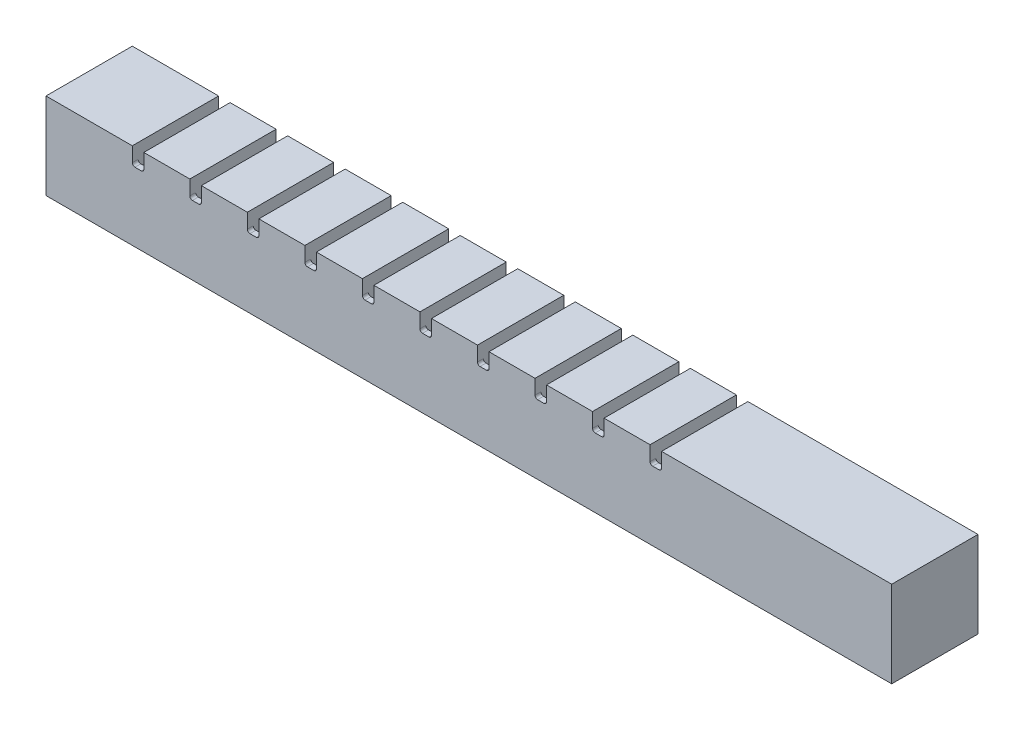
from build123d import *

# Parameters (mm, degrees)
SKETCH1_W                       = 8
SKETCH1_H                       = 15
FIRST_CHAMBER_BLOCK_DEPTH       = 15
SKETCH2_W                       = 6
SKETCH2_H                       = 11
FIRST_CHAMBER_CAVITY_DEPTH      = 13
SKETCH3_W                       = 15
SKETCH3_H                       = 3
CHAMBER_SPACER_DEPTH            = 2
PATTERN_CHAMBERS_COUNT          = 11
PATTERN_CHAMBERS_PITCH          = 10
SKETCH4_W                       = 15
SKETCH4_H                       = 12
THICKEN_END_1_DEPTH             = 2
SKETCH5_W                       = 15
SKETCH5_H                       = 15
THICKEN_END_2_DEPTH             = 2
SKETCH6_W                       = 94
SKETCH6_H                       = 2
CENTRAL_AIR_CHANNEL_DEPTH       = 2
AUFSATZ_LINEAR_AUSTRAGEN3_REACH = 106.183
SCHNITT_LINEAR_AUSTRAGEN2_DEPTH = 113.026782512
LINEARES_MUSTER8_COUNT          = 10
LINEARES_MUSTER8_PITCH          = 10
SKETCH17_W                      = 15
SKETCH17_H                      = 15
BOSS_EXTRUDE1_DEPTH             = 30
SKETCH18_W                      = 15
SKETCH18_H                      = 15
BOSS_EXTRUDE2_DEPTH             = 5
CUT_EXTRUDE1_DEPTH              = 12


with BuildPart() as part:
    # Sketch1 → first chamber block (new body)
    with BuildSketch(Plane.XY):
        with Locations((4, 7.5)):
            Rectangle(SKETCH1_W, SKETCH1_H)
    extrude(amount=FIRST_CHAMBER_BLOCK_DEPTH)

    # Sketch2 → first chamber cavity (cut)
    with BuildSketch(Plane.XZ):
        with Locations((4, 7.5)):
            Rectangle(SKETCH2_W, SKETCH2_H)
    extrude(amount=-FIRST_CHAMBER_CAVITY_DEPTH, mode=Mode.SUBTRACT)

    # Sketch3 → chamber spacer (add)
    with BuildSketch(Plane(origin=(8, 0, 0), x_dir=(0, 0, -1), z_dir=(1, 0, 0))):
        with Locations((-7.5, 1.5)):
            Rectangle(SKETCH3_W, SKETCH3_H)
    extrude(amount=CHAMBER_SPACER_DEPTH)


with BuildPart() as pattern_chambers_1:
    # pattern chambers: pattern copy
    add(part.part.moved(Location(Vector(1, 0, 0) * (1 * PATTERN_CHAMBERS_PITCH))))


with BuildPart() as pattern_chambers_2:
    # pattern chambers: pattern copy
    add(part.part.moved(Location(Vector(1, 0, 0) * (2 * PATTERN_CHAMBERS_PITCH))))


with BuildPart() as pattern_chambers_3:
    # pattern chambers: pattern copy
    add(part.part.moved(Location(Vector(1, 0, 0) * (3 * PATTERN_CHAMBERS_PITCH))))


with BuildPart() as pattern_chambers_4:
    # pattern chambers: pattern copy
    add(part.part.moved(Location(Vector(1, 0, 0) * (4 * PATTERN_CHAMBERS_PITCH))))


with BuildPart() as pattern_chambers_5:
    # pattern chambers: pattern copy
    add(part.part.moved(Location(Vector(1, 0, 0) * (5 * PATTERN_CHAMBERS_PITCH))))


with BuildPart() as pattern_chambers_6:
    # pattern chambers: pattern copy
    add(part.part.moved(Location(Vector(1, 0, 0) * (6 * PATTERN_CHAMBERS_PITCH))))


with BuildPart() as pattern_chambers_7:
    # pattern chambers: pattern copy
    add(part.part.moved(Location(Vector(1, 0, 0) * (7 * PATTERN_CHAMBERS_PITCH))))


with BuildPart() as pattern_chambers_8:
    # pattern chambers: pattern copy
    add(part.part.moved(Location(Vector(1, 0, 0) * (8 * PATTERN_CHAMBERS_PITCH))))


with BuildPart() as pattern_chambers_9:
    # pattern chambers: pattern copy
    add(part.part.moved(Location(Vector(1, 0, 0) * (9 * PATTERN_CHAMBERS_PITCH))))


with BuildPart() as pattern_chambers_10:
    # pattern chambers: pattern copy
    add(part.part.moved(Location(Vector(1, 0, 0) * (10 * PATTERN_CHAMBERS_PITCH))))

    # combine into 1 solid body: union pattern chambers_9, pattern chambers_8, pattern chambers_7, pattern chambers_6, pattern chambers_5, pattern chambers_4, pattern chambers_3, pattern chambers_2, pattern chambers_1, part
    add(pattern_chambers_9.part)
    add(pattern_chambers_8.part)
    add(pattern_chambers_7.part)
    add(pattern_chambers_6.part)
    add(pattern_chambers_5.part)
    add(pattern_chambers_4.part)
    add(pattern_chambers_3.part)
    add(pattern_chambers_2.part)
    add(pattern_chambers_1.part)
    add(part.part)

    # Sketch4 → thicken end 1 (add)
    with BuildSketch(Plane(origin=(108, 0, 0), x_dir=(0, 0, -1), z_dir=(1, 0, 0))):
        with Locations((-7.5, 9)):
            Rectangle(SKETCH4_W, SKETCH4_H)
    extrude(amount=THICKEN_END_1_DEPTH)

    # Sketch5 → thicken end 2 (add)
    with BuildSketch(Plane.ZY):
        with Locations((7.5, 7.5)):
            Rectangle(SKETCH5_W, SKETCH5_H)
    extrude(amount=THICKEN_END_2_DEPTH)

    # Sketch6 → central air channel (cut)
    with BuildSketch(Plane.XZ):
        with Locations((54, 7.5)):
            Rectangle(SKETCH6_W, SKETCH6_H)
    extrude(amount=-CENTRAL_AIR_CHANNEL_DEPTH, mode=Mode.SUBTRACT)

    # Skizze3 → Aufsatz-Linear austragen3 (add, up to next)
    with BuildSketch(Plane(origin=(8, 0, 0), x_dir=(0, 0, -1), z_dir=(1, 0, 0)), mode=Mode.PRIVATE) as aufsatz_linear_austragen3_sk1:
        Polygon((-15, 3), (-13.5, 3), (-14, 12.5), (-15, 12.5), align=None)
    aufsatz_linear_austragen3_tool1 = extrude(aufsatz_linear_austragen3_sk1.sketch, amount=AUFSATZ_LINEAR_AUSTRAGEN3_REACH, mode=Mode.PRIVATE) - pattern_chambers_10.part
    # Skizze3 → Aufsatz-Linear austragen3 (add, up to next)
    with BuildSketch(Plane(origin=(8, 0, 0), x_dir=(0, 0, -1), z_dir=(1, 0, 0)), mode=Mode.PRIVATE) as aufsatz_linear_austragen3_sk2:
        Polygon((0, 12.5), (0, 3), (-1.5, 3), (-1, 12.5), align=None)
    aufsatz_linear_austragen3_tool2 = extrude(aufsatz_linear_austragen3_sk2.sketch, amount=AUFSATZ_LINEAR_AUSTRAGEN3_REACH, mode=Mode.PRIVATE) - pattern_chambers_10.part
    aufsatz_linear_austragen3_1 = aufsatz_linear_austragen3_tool1.solids().sort_by_distance((8, 7.433333, 14.366667))[0]
    add(aufsatz_linear_austragen3_1)
    aufsatz_linear_austragen3_2 = aufsatz_linear_austragen3_tool2.solids().sort_by_distance((8, 7.433333, 0.633333))[0]
    add(aufsatz_linear_austragen3_2)
    aufsatz_linear_austragen3 = aufsatz_linear_austragen3_1 + aufsatz_linear_austragen3_2  # Aufsatz-Linear austragen3 as one shape, for the pattern or mirror that repeats it

    # Skizze5 → Schnitt-Linear austragen2 (cut, through all)
    with BuildSketch(Plane(origin=(0, 0, 0), x_dir=(-1, 0, 0), z_dir=(0, 0, -1))):
        with BuildLine():
            Line((-10, 12.5), (-8, 12.5))
            Line((-8, 12.5), (-8, 12.45))
            ThreePointArc((-8, 12.45), (-8.131801948, 12.131801948), (-8.45, 12))
            Line((-8.45, 12), (-9.55, 12))
            ThreePointArc((-9.55, 12), (-9.868198052, 12.131801948), (-10, 12.45))
            Line((-10, 12.45), (-10, 12.5))
        make_face()
    schnitt_linear_austragen2 = extrude(amount=-SCHNITT_LINEAR_AUSTRAGEN2_DEPTH, mode=Mode.SUBTRACT)

    # Lineares Muster8: Aufsatz-Linear austragen3, Schnitt-Linear austragen2 ×10
    with Locations(*[(i * LINEARES_MUSTER8_PITCH, 0, 0) for i in range(1, LINEARES_MUSTER8_COUNT)]):
        add(aufsatz_linear_austragen3)
        add(schnitt_linear_austragen2, mode=Mode.SUBTRACT)

    # Sketch17 → Boss-Extrude1 (add)
    with BuildSketch(Plane(origin=(110, 0, 0), x_dir=(0, 0, -1), z_dir=(1, 0, 0))):
        with Locations((-7.5, 7.5)):
            Rectangle(SKETCH17_W, SKETCH17_H)
    extrude(amount=BOSS_EXTRUDE1_DEPTH)

    # Sketch18 → Boss-Extrude2 (add)
    with BuildSketch(Plane.ZY.offset(2)):
        with Locations((7.5, 7.5)):
            Rectangle(SKETCH18_W, SKETCH18_H)
    extrude(amount=BOSS_EXTRUDE2_DEPTH)

    # Sketch19 → Cut-Extrude1 (cut)
    with BuildSketch(Plane.XZ):
        Polygon((131.828427125, 7.5), (137.328427125, 2), (137.328427125, 13), align=None)
        Polygon((126.328427125, 2), (134.5, 2), (130.414213562, 6.085786438), align=None)
        Polygon((130.414213562, 8.914213562), (134.5, 13), (126.328427125, 13), align=None)
        Polygon((112.5, 2), (120.671572875, 2), (116.585786438, 6.085786438), align=None)
        Polygon((118, 7.5), (122.5, 3), (122.5, 12), align=None)
        Polygon((124.5, 12), (124.5, 3), (129, 7.5), align=None)
        Polygon((116.585786438, 8.914213562), (120.671572875, 13), (112.5, 13), align=None)
        Polygon((109.671572875, 13), (109.671572875, 2), (115.171572875, 7.5), align=None)
    extrude(amount=-CUT_EXTRUDE1_DEPTH, mode=Mode.SUBTRACT)


solid = pattern_chambers_10.part
